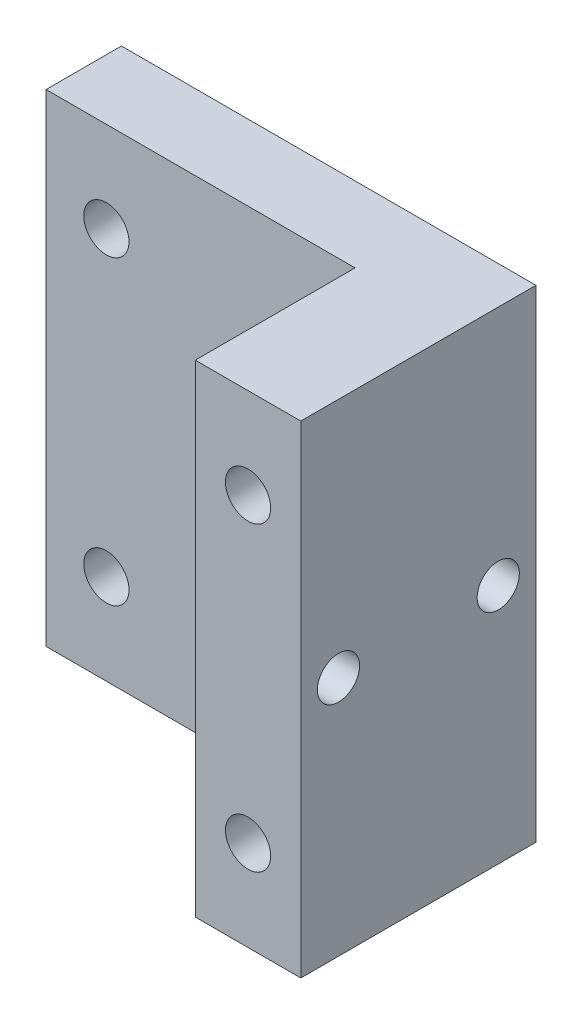
from build123d import *

# Parameters (mm, degrees)
SKETCH1_W           = 27.5
SKETCH1_H           = 32
SKETCH1_R           = 1.500000001
SKETCH1_R_2         = 1.5
BOSS_EXTRUDE1_DEPTH = 5
SKETCH1_3_W         = 7
SKETCH1_3_H         = 32
SKETCH1_3_R         = 1.500000001
SKETCH1_3_R_2       = 1.5
BOSS_EXTRUDE2_DEPTH = 15.6
SKETCH2_R           = 1.4
CUT_EXTRUDE1_DEPTH  = 348.686930656


with BuildPart() as part:
    # Sketch1 → Boss-Extrude1 (new body)
    with BuildSketch(Plane.XY):
        with Locations((360.365409639, -330.24643211)):
            Rectangle(SKETCH1_W, SKETCH1_H)
        with Locations((370.615409639, -340.24643211)):
            Circle(SKETCH1_R, mode=Mode.SUBTRACT)
        with Locations((370.615409639, -320.24643211)):
            Circle(SKETCH1_R_2, mode=Mode.SUBTRACT)
        with Locations((350.615409639, -320.24643211)):
            Circle(SKETCH1_R_2, mode=Mode.SUBTRACT)
        with Locations((350.615409639, -340.24643211)):
            Circle(SKETCH1_R_2, mode=Mode.SUBTRACT)
    extrude(amount=BOSS_EXTRUDE1_DEPTH)

    # Sketch1<3> → Boss-Extrude2 (add)
    with BuildSketch(Plane.XY):
        with Locations((370.615409639, -330.24643211)):
            Rectangle(SKETCH1_3_W, SKETCH1_3_H)
        with Locations((370.615409639, -340.24643211)):
            Circle(SKETCH1_3_R, mode=Mode.SUBTRACT)
        with Locations((370.615409639, -320.24643211)):
            Circle(SKETCH1_3_R_2, mode=Mode.SUBTRACT)
    extrude(amount=BOSS_EXTRUDE2_DEPTH)

    # Sketch2 → Cut-Extrude1 (cut, through all)
    with BuildSketch(Plane(origin=(374.115409639, 0, 0), x_dir=(0, 0, -1), z_dir=(1, 0, 0))):
        with Locations((-13.100079331, -330.24643211)):
            Circle(SKETCH2_R)
        with Locations((-2.500079331, -330.24643211)):
            Circle(SKETCH2_R)
    extrude(amount=-CUT_EXTRUDE1_DEPTH, mode=Mode.SUBTRACT)


solid = part.part
